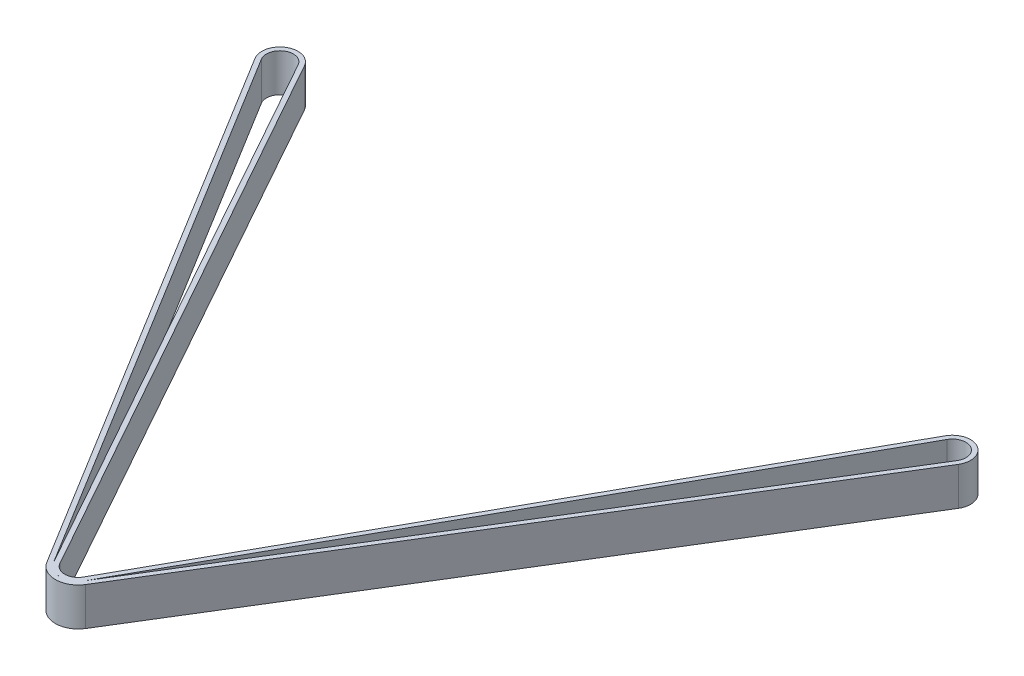
from build123d import *

# Parameters (mm, degrees)
BOSS_EXTRUDE1_DEPTH = 2.835


with BuildPart() as part:
    # Sketch1 → Boss-Extrude1 (new, symmetric)
    with BuildSketch(Plane(origin=(0, 0, 0), x_dir=(1, 0, 0), z_dir=(0, 1, 0))):
        with BuildLine():
            Line((-2.880130474, -81.770878159), (-52.291496887, -1.408950679))
            ThreePointArc((-52.291496887, -1.408950679), (-51.360046662, 2.320856109), (-47.650828196, 1.310531127))
            Line((-47.650828196, 1.310531127), (-1.746596137, -80.974372585))
            ThreePointArc((-1.746596137, -80.974372585), (0, -82), (1.746596137, -80.974372585))
            Line((1.746596137, -80.974372585), (47.650828196, 1.310531127))
            ThreePointArc((47.650828196, 1.310531127), (51.360046662, 2.320856109), (52.291496887, -1.408950679))
            Line((52.291496887, -1.408950679), (2.880130474, -81.770878159))
            ThreePointArc((2.880130474, -81.770878159), (0, -83.381), (-2.880130474, -81.770878159))
        make_face()
        with BuildLine():
            Line((-2.292348745, -81.409474453), (-51.703715158, -1.047546974))
            ThreePointArc((-51.703715158, -1.047546974), (-51.011187109, 1.725543575), (-48.253403863, 0.974372585))
            Line((-48.253403863, 0.974372585), (-2.349171804, -81.310531127))
            ThreePointArc((-2.349171804, -81.310531127), (0, -82.69), (2.349171804, -81.310531127))
            Line((2.349171804, -81.310531127), (48.253403863, 0.974372585))
            ThreePointArc((48.253403863, 0.974372585), (51.011187109, 1.725543575), (51.703715158, -1.047546974))
            Line((51.703715158, -1.047546974), (2.292348745, -81.409474453))
            ThreePointArc((2.292348745, -81.409474453), (0, -82.691), (-2.292348745, -81.409474453))
        make_face(mode=Mode.SUBTRACT)
    extrude(amount=BOSS_EXTRUDE1_DEPTH, both=True)


solid = part.part
